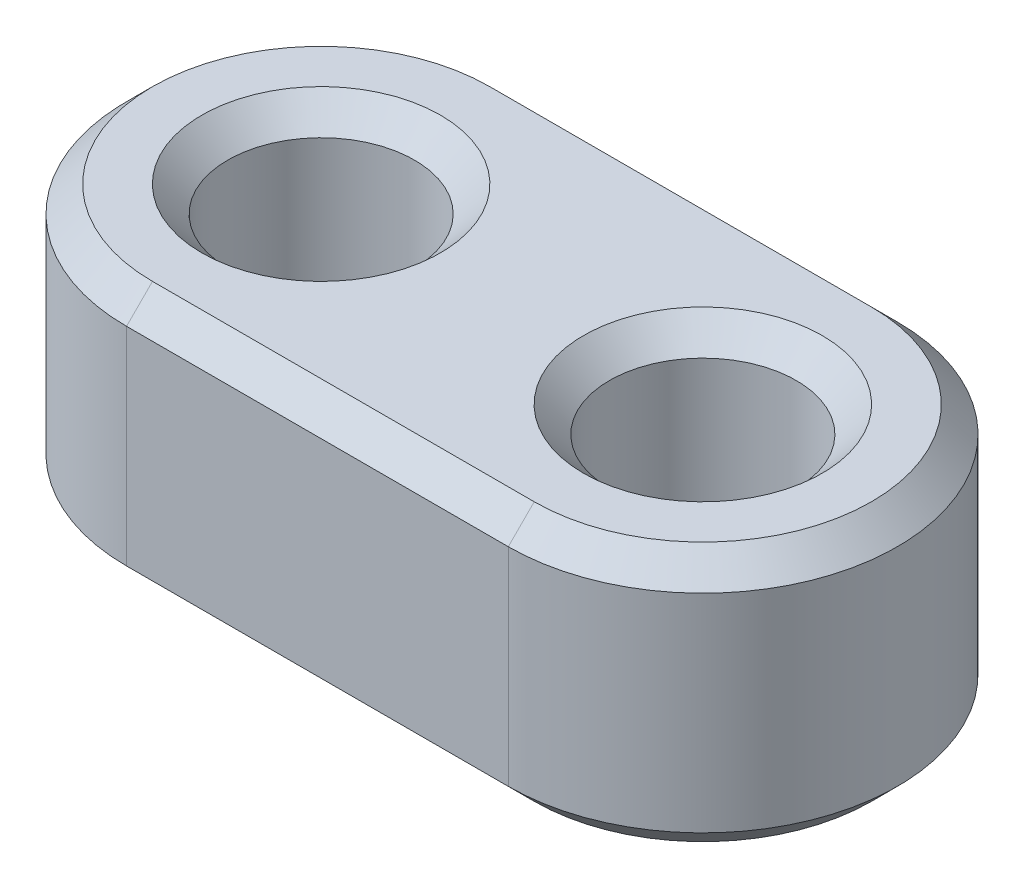
from build123d import *

# Parameters (mm, degrees)
SKETCH2_R           = 2.286
BOSS_EXTRUDE1_DEPTH = 6.35
SKETCH4_R           = 2.286
CUT_EXTRUDE2_DEPTH  = 17.185114529
CHAMFER1_SIZE       = 0.635


with BuildPart() as part:
    # Sketch2 → Boss-Extrude1 (new body)
    with BuildSketch(Plane(origin=(0, 0, 0), x_dir=(1, 0, 0), z_dir=(0, 1, 0))):
        with BuildLine():
            Line((0, 4.7625), (14.105106383, 4.7625))
            Line((14.105106383, 4.7625), (14.105106383, -4.7625))
            Line((14.105106383, -4.7625), (0, -4.7625))
            ThreePointArc((0, -4.7625), (-4.7625, 0), (0, 4.7625))
        make_face()
        Circle(SKETCH2_R, mode=Mode.SUBTRACT)
    extrude(amount=BOSS_EXTRUDE1_DEPTH)

    # Sketch4 → Cut-Extrude2 (cut, through all)
    with BuildSketch(Plane(origin=(0, 6.35, 0), x_dir=(1, 0, 0), z_dir=(0, 1, 0))):
        with BuildLine():
            Line((14.105106383, -4.7625), (14.105106383, 1.8e-08))
            ThreePointArc((14.105106383, 1.8e-08), (12.710202435, -3.367596039), (9.342606383, -4.7625))
            Line((9.342606383, -4.7625), (14.105106383, -4.7625))
        make_face()
        with BuildLine():
            Line((14.105106383, 4.7625), (9.342606383, 4.7625))
            ThreePointArc((9.342606383, 4.7625), (12.710202422, 3.367596052), (14.105106383, 1.8e-08))
            Line((14.105106383, 1.8e-08), (14.105106383, 4.7625))
        make_face()
        with Locations((9.342606383, 0)):
            Circle(SKETCH4_R)
    extrude(amount=-CUT_EXTRUDE2_DEPTH, mode=Mode.SUBTRACT)

    # Chamfer1
    chamfer1_edges = [part.edges().sort_by_distance(p)[0] for p in [
        (-2.286, 0, 0),
        (-2.286, 6.35, 0),
        (7.056606383, 6.35, 0),
        (7.056606383, 0, 0),
        (4.671303191, 0, -4.7625),
        (-4.7625, 0, 0),
        (14.105106383, 0, 0),
        (4.671303191, 0, 4.7625),
        (4.671303191, 6.35, -4.7625),
        (-4.7625, 6.35, 0),
        (14.105106383, 6.35, 0),
        (4.671303191, 6.35, 4.7625),
    ]]
    chamfer(chamfer1_edges, length=CHAMFER1_SIZE)


solid = part.part
